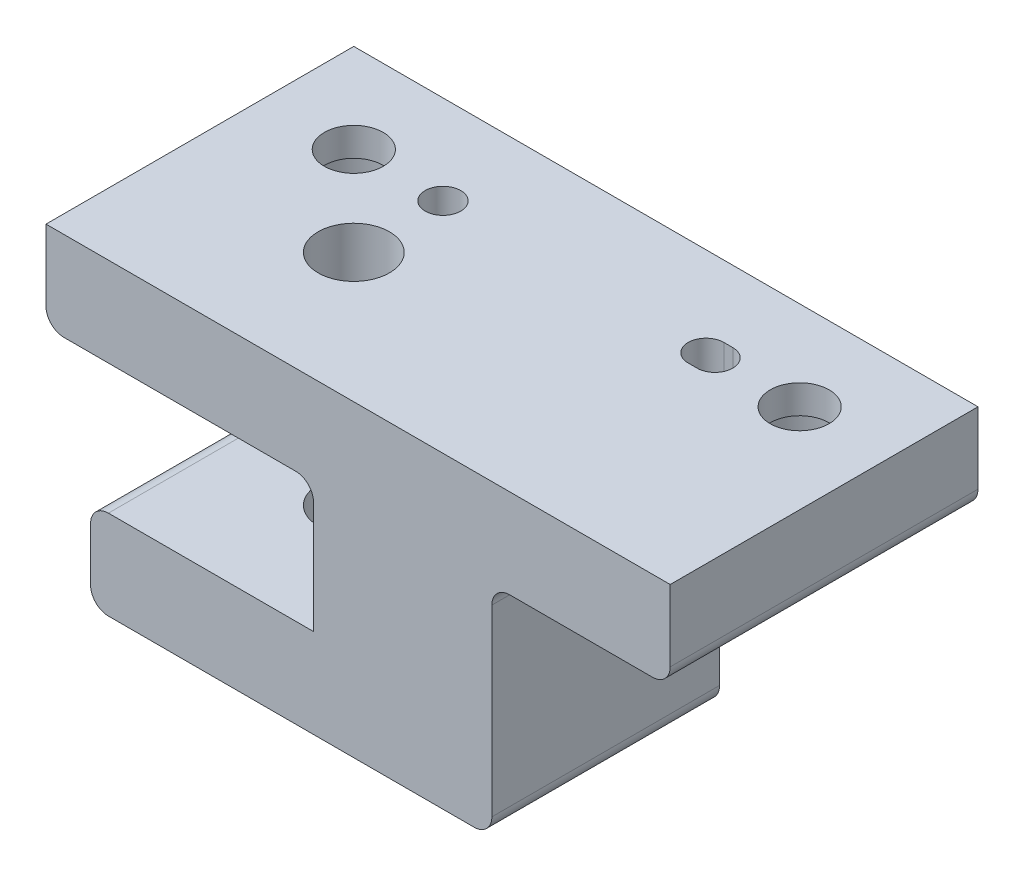
from build123d import *

# Parameters (mm, degrees)
SKETCH_8_W                = 70
SKETCH_8_H                = 30
EXTRUDE_3_DEPTH           = 34.57
SKETCH_9_W                = 30
SKETCH_9_H                = 14.57
SKETCH_9_W_2              = 20
CUT_EXTRUDE_3_DEPTH       = 67.664217758
OTHER_1_OUTLINE_R         = 5.5
OTHER_1_DEPTH             = 5
HOLE_WIZARD_2_D           = 4.5
HOLE_WIZARD_2_DEPTH       = 10
HOLE_WIZARD_2_CBORE_D     = 8
HOLE_WIZARD_2_CBORE_DEPTH = 4.6
BACK_REACH                = 69.458
SKETCH_16_W               = 70
SKETCH_16_H               = 8.975361008
MM_1_D                    = 4
MM_1_DEPTH                = 5
MM_1_TIP                  = 1.201721238
CUT_EXTRUDE_5_DEPTH       = 5
SKETCH_24_W               = 5
SKETCH_24_H               = 21.024638992
SKETCH_24_W_2             = 20
CUT_EXTRUDE_6_DEPTH       = 10
HOLE_WIZARD_3_D           = 6.6
HOLE_WIZARD_3_DEPTH       = 10
HOLE_WIZARD_3_CBORE_D     = 11
HOLE_WIZARD_3_CBORE_DEPTH = 6.8
FILLET_1_R                = 2
SKETCH_29_W               = 10
SKETCH_29_H               = 2
EXTRUDE_5_DEPTH           = 2.329281552
FILLET_3_R                = 2
CUT_EXTRUDE_7_DEPTH       = 0.5
EXTRUDE_START             = 5.016506595
EXTRUDE_6_DEPTH           = 5.016506595
SKETCH_33_R               = 4
CUT_EXTRUDE_8_DEPTH       = 24.57
CUT_EXTRUDE_9_DEPTH       = 67.093990688


# Read off the part's stored shape, not the designer's step: 孔1
with BuildPart() as part:
    # 草图8 → 凸台-拉伸3 (new body)
    with BuildSketch(Plane(origin=(0, 0, 0), x_dir=(1, 0, 0), z_dir=(0, 1, 0))):
        with Locations((13.466824006, -16.724598186)):
            Rectangle(SKETCH_8_W, SKETCH_8_H)
    extrude(amount=EXTRUDE_3_DEPTH)

    # 草图9 → 切除-拉伸3 (cut, through all)
    with BuildSketch(Plane.XY.offset(31.724598186)):
        with Locations((-6.533175994, 17.285)):
            Rectangle(SKETCH_9_W, SKETCH_9_H)
        with Locations((38.466824006, 17.285)):
            Rectangle(SKETCH_9_W_2, SKETCH_9_H)
    extrude(amount=-CUT_EXTRUDE_3_DEPTH, mode=Mode.SUBTRACT)

    # 孔1 outline → 孔1 (cut)
    with BuildSketch(Plane(origin=(0, 0, 0), x_dir=(1, 0, 0), z_dir=(0, 1, 0))):
        with Locations((-1.533175994, -21.724598186)):
            Circle(OTHER_1_OUTLINE_R)
    extrude(amount=OTHER_1_DEPTH, mode=Mode.SUBTRACT)

    # 打孔尺寸(%根据)内六角圆柱头螺钉的类型2
    with Locations(Plane(origin=(-1.533175994, 10, 21.724598186), x_dir=(1, 0, 0), z_dir=(0, 1, 0))):
        with Locations((0, 0)):
            CounterBoreHole(HOLE_WIZARD_2_D / 2, HOLE_WIZARD_2_CBORE_D / 2, HOLE_WIZARD_2_CBORE_DEPTH, depth=HOLE_WIZARD_2_DEPTH)

    # back: up to this face of the body (flat: up to its plane)
    back_end = Plane(part.part.faces().sort_by_distance((-6.533175994, 24.57, 16.724598186))[0])
    # 草图16 → back (cut, up to the picked face)
    with BuildSketch(Plane(origin=(0, 0, 0), x_dir=(1, 0, 0), z_dir=(0, 1, 0)), mode=Mode.PRIVATE) as back_sk1:
        with Locations((13.466824006, -6.21227869)):
            Rectangle(SKETCH_16_W, SKETCH_16_H)
    back_tool1 = split(extrude(back_sk1.sketch, amount=BACK_REACH, mode=Mode.PRIVATE), bisect_by=back_end, keep=Keep.BOTH, mode=Mode.PRIVATE)
    add(back_tool1.solids().sort_by(Axis((13.466824, 0, 6.212279), (0, 1, 0)))[0], mode=Mode.SUBTRACT)

    # 大小mm 暗销孔1
    with Locations(Plane(origin=(-1.533175994, 34.57, 11.724598186), x_dir=(0, 0, 1), z_dir=(0, 1, 0))):
        with Locations((0, 0)):
            Hole(MM_1_D / 2, depth=MM_1_DEPTH)
            with Locations((0, 0, -(MM_1_DEPTH + MM_1_TIP / 2))):  # 118° drill point
                Cone(0, MM_1_D / 2, MM_1_TIP, mode=Mode.SUBTRACT)

    # 草图23 → 切除-拉伸5 (cut)
    with BuildSketch(Plane.XZ.offset(-34.57)):
        with BuildLine():
            Line((28.966824006, 9.724598186), (27.966824006, 9.724598186))
            ThreePointArc((27.966824006, 9.724598186), (25.966824006, 11.724598186), (27.966824006, 13.724598186))
            Line((27.966824006, 13.724598186), (28.966824006, 13.724598186))
            ThreePointArc((28.966824006, 13.724598186), (30.966824006, 11.724598186), (28.966824006, 9.724598186))
        make_face()
    extrude(amount=CUT_EXTRUDE_5_DEPTH, mode=Mode.SUBTRACT)

    # 草图24 → 切除-拉伸6 (cut)
    with BuildSketch(Plane(origin=(0, 0, 0), x_dir=(1, 0, 0), z_dir=(0, 1, 0))):
        with Locations((-19.033175994, -21.21227869)):
            Rectangle(SKETCH_24_W, SKETCH_24_H)
        with Locations((38.466824006, -21.21227869)):
            Rectangle(SKETCH_24_W_2, SKETCH_24_H)
    extrude(amount=CUT_EXTRUDE_6_DEPTH, mode=Mode.SUBTRACT)

    # 打孔尺寸(%根据)内六角圆柱头螺钉的类型3
    with Locations(Plane(origin=(-11.533175994, 24.57, 11.724598186), x_dir=(0, 0, -1), z_dir=(0, -1, 0))):
        with Locations((0, 0), (0, 50)):
            CounterBoreHole(HOLE_WIZARD_3_D / 2, HOLE_WIZARD_3_CBORE_D / 2, HOLE_WIZARD_3_CBORE_DEPTH, depth=HOLE_WIZARD_3_DEPTH)

    # 圆角1
    fillet_1_edges = [part.edges().sort_by_distance(p)[0] for p in [
        (-16.533175994, 0, 21.21227869),
        (-16.533175994, 10, 21.21227869),
        (28.466824006, 0, 21.21227869),
        (-21.533175994, 24.57, 16.724598186),
        (48.466824006, 24.57, 16.724598186),
        (8.466824006, 24.57, 21.21227869),
        (28.466824006, 24.57, 21.21227869),
    ]]
    fillet(fillet_1_edges, radius=FILLET_1_R)

    # 草图29 → 凸台-拉伸5 (add)
    with BuildSketch(Plane(origin=(0, 0, 10.699959194), x_dir=(-1, 0, 0), z_dir=(0, 0, -1))):
        with Locations((0, -1)):
            Rectangle(SKETCH_29_W, SKETCH_29_H)
    extrude(amount=-EXTRUDE_5_DEPTH)

    # 圆角3
    fillet_3_edges = [part.edges().sort_by_distance(p)[0] for p in [
        (-5, -2, 11.86459997),
        (5, -2, 11.86459997),
    ]]
    fillet(fillet_3_edges, radius=FILLET_3_R - 0.0001)  # a hair under: the kernel refuses the full size

    # 草图30 → 切除-拉伸7 (cut)
    with BuildSketch(Plane.XY.offset(31.724598186)):
        with BuildLine():
            Line((-14.533175994, 0), (26.466824006, 0))
            ThreePointArc((26.466824006, 0), (27.881037569, 0.585786438), (28.466824006, 2))
            Line((28.466824006, 2), (28.466824006, 22.57))
            ThreePointArc((28.466824006, 22.57), (29.052610444, 23.984213562), (30.466824006, 24.57))
            Line((30.466824006, 24.57), (46.466824006, 24.57))
            ThreePointArc((46.466824006, 24.57), (47.881037569, 25.155786438), (48.466824006, 26.57))
            Line((48.466824006, 26.57), (48.466824006, 34.57))
            Line((48.466824006, 34.57), (-21.533175994, 34.57))
            Line((-21.533175994, 34.57), (-21.533175994, 26.57))
            ThreePointArc((-21.533175994, 26.57), (-20.947389556, 25.155786438), (-19.533175994, 24.57))
            Line((-19.533175994, 24.57), (6.466824006, 24.57))
            ThreePointArc((6.466824006, 24.57), (7.881037569, 23.984213562), (8.466824006, 22.57))
            Line((8.466824006, 22.57), (8.466824006, 10))
            Line((8.466824006, 10), (-14.533175994, 10))
            ThreePointArc((-14.533175994, 10), (-15.947389556, 9.414213562), (-16.533175994, 8))
            Line((-16.533175994, 8), (-16.533175994, 2))
            ThreePointArc((-16.533175994, 2), (-15.947389556, 0.585786438), (-14.533175994, 0))
        make_face()
    extrude(amount=-CUT_EXTRUDE_7_DEPTH, mode=Mode.SUBTRACT)

    # 草图31 → 凸台-拉伸6 (add)
    with BuildSketch(Plane.XY.offset(31.224598186).offset(EXTRUDE_START)):
        with BuildLine():
            Line((-14.533175994, 0), (26.466824006, 0))
            ThreePointArc((26.466824006, 0), (27.881037569, 0.585786438), (28.466824006, 2))
            Line((28.466824006, 2), (28.466824006, 22.57))
            ThreePointArc((28.466824006, 22.57), (29.052610444, 23.984213562), (30.466824006, 24.57))
            Line((30.466824006, 24.57), (46.466824006, 24.57))
            ThreePointArc((46.466824006, 24.57), (47.881037569, 25.155786438), (48.466824006, 26.57))
            Line((48.466824006, 26.57), (48.466824006, 34.57))
            Line((48.466824006, 34.57), (-21.533175994, 34.57))
            Line((-21.533175994, 34.57), (-21.533175994, 26.57))
            ThreePointArc((-21.533175994, 26.57), (-20.947389556, 25.155786438), (-19.533175994, 24.57))
            Line((-19.533175994, 24.57), (6.466824006, 24.57))
            ThreePointArc((6.466824006, 24.57), (7.881037569, 23.984213562), (8.466824006, 22.57))
            Line((8.466824006, 22.57), (8.466824006, 10))
            Line((8.466824006, 10), (-14.533175994, 10))
            ThreePointArc((-14.533175994, 10), (-15.947389556, 9.414213562), (-16.533175994, 8))
            Line((-16.533175994, 8), (-16.533175994, 2))
            ThreePointArc((-16.533175994, 2), (-15.947389556, 0.585786438), (-14.533175994, 0))
        make_face()
    extrude(amount=-EXTRUDE_6_DEPTH)

    # 草图33 → 切除-拉伸8 (cut)
    with BuildSketch(Plane(origin=(0, 34.57, 0), x_dir=(1, 0, 0), z_dir=(0, 1, 0))):
        with Locations(Location((-1.533175994, -21.724598186, 0), (0, 0, 270))):
            Circle(SKETCH_33_R)
    extrude(amount=-CUT_EXTRUDE_8_DEPTH, mode=Mode.SUBTRACT)

    # 草图34 → 切除-拉伸9 (cut, through all)
    with BuildSketch(Plane.XZ.offset(-24.57)):
        with BuildLine():
            Line((-17.033175994, 17.224598186), (-11.533175994, 17.224598186))
            ThreePointArc((-11.533175994, 17.224598186), (-7.644088697, 15.613685483), (-6.033175994, 11.724598186))
            Line((-6.033175994, 11.724598186), (-6.033175994, 6.224598186))
            Line((-6.033175994, 6.224598186), (-17.033175994, 6.224598186))
            Line((-17.033175994, 6.224598186), (-17.033175994, 17.224598186))
        make_face()
    extrude(amount=CUT_EXTRUDE_9_DEPTH, mode=Mode.SUBTRACT)


solid = part.part
